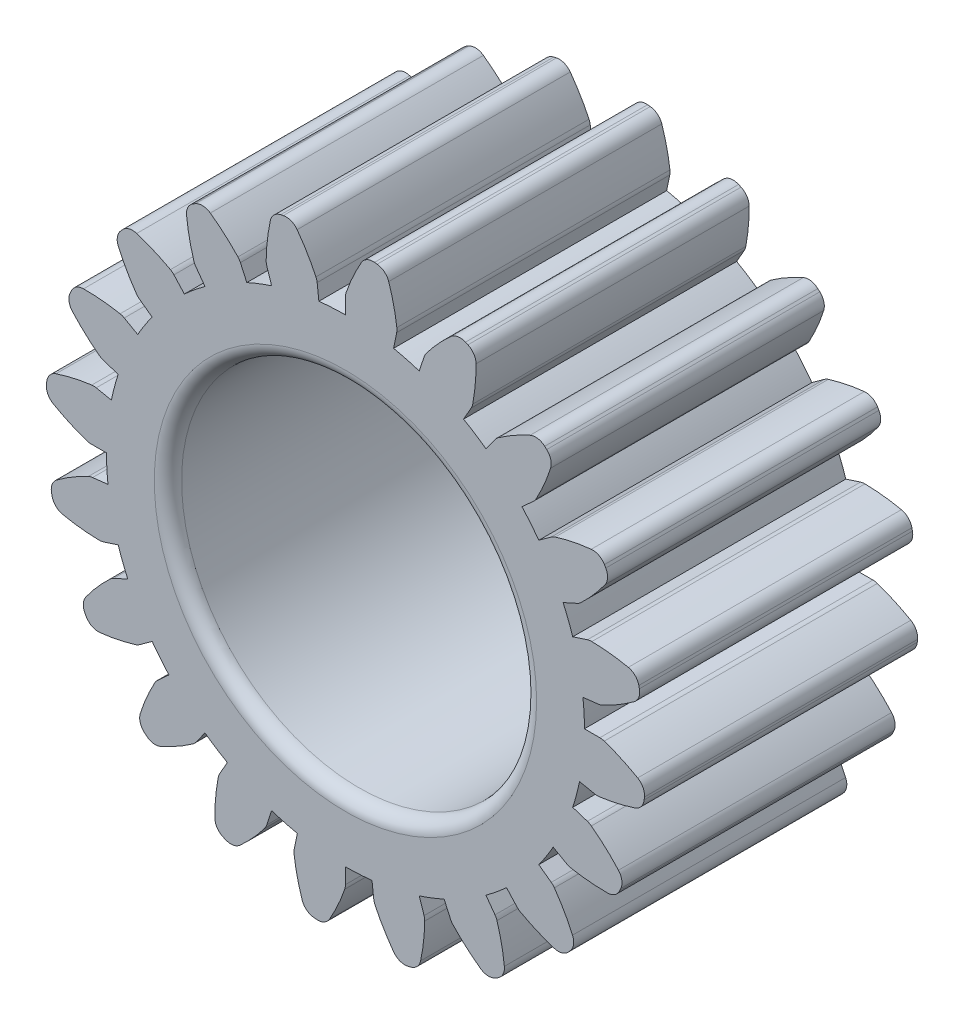
from build123d import *

# Parameters (mm, degrees)
SKETCH1_R                = 6.5
BOSS_EXTRUDE5_DEPTH      = 10
BOSS_EXTRUDE6_DEPTH      = 10
FILLET3_R                = 0.5
CIRPATTERN5_COUNT        = 20
FILLET3_OF_CIRPATTERN5_R = 0.5
FILLET2_R                = 0.5


with BuildPart() as part:
    # Sketch1 → Boss-Extrude5 (new body)
    with BuildSketch(Plane(origin=(0, 0, 0), x_dir=(0, 1, 0), z_dir=(0, 0, 1))):
        with BuildLine():
            ThreePointArc((1.761770315, 8.570803075), (0.885430147, 8.705085494), (0, 8.75))
            ThreePointArc((0, 8.75), (-6.187184335, -6.187184335), (8.75, 0))
            ThreePointArc((8.75, 0), (6.781518645, 5.529331322), (1.761770315, 8.570803075))
        make_face()
        Circle(SKETCH1_R, mode=Mode.SUBTRACT)
    extrude(amount=BOSS_EXTRUDE5_DEPTH)

    # Sketch2 → Boss-Extrude6 (add)
    with BuildSketch(Plane(origin=(0, 0, 0), x_dir=(0, 1, 0), z_dir=(0, 0, 1))):
        with BuildLine():
            Line((1.892025788, 9.204480462), (1.761770315, 8.570803075))
            ThreePointArc((1.761770315, 8.570803075), (0.885430147, 8.705085494), (0, 8.75))
            Line((0, 8.75), (0, 9.396926208))
            ThreePointArc((0, 9.396926208), (0.324589742, 10.209430853), (0.749151549, 10.974459985))
            ThreePointArc((0.749151549, 10.974459985), (1.113112185, 10.943536049), (1.475845419, 10.900544954))
            ThreePointArc((1.475845419, 10.900544954), (1.737677423, 10.065699878), (1.892025788, 9.204480462))
        make_face()
    boss_extrude6 = extrude(amount=BOSS_EXTRUDE6_DEPTH)

    # Fillet3
    fillet3_edges = [part.edges().sort_by_distance(p)[0] for p in [
        (-10.900544954, 1.475845419, 5),
        (-10.974459985, 0.749151549, 5),
        (-9.396926208, 0, 5),
        (-9.204480462, 1.892025788, 5),
    ]]
    fillet(fillet3_edges, radius=FILLET3_R)

    # CirPattern5: Boss-Extrude6 ×20 about axis
    cirpattern5_axis = Axis((0, 0, 10), (0, 0, -1))
    for i in range(1, CIRPATTERN5_COUNT):
        add(boss_extrude6.rotate(cirpattern5_axis, i * 360 / CIRPATTERN5_COUNT))

    # Fillet3 of CirPattern5
    fillet3_of_cirpattern5_edges = [part.edges().sort_by_distance(p)[0] for p in [
        (-9.910972994, 4.772066042, 5),
        (-10.205831121, 4.103780102, 5),
        (-8.937007903, 2.903809893, 5),
        (-8.169313, 4.643764342, 5),
        (-7.951245944, 7.601163591, 5),
        (-8.438184399, 7.056702066, 5),
        (-7.602272997, 5.523374642, 5),
        (-6.334476263, 6.940938887, 5),
        (-5.213195541, 9.686206288, 5),
        (-5.844549396, 9.318864864, 5),
        (-5.523374642, 7.602272997, 5),
        (-3.879576854, 8.558685973, 5),
        (-1.964841236, 10.823095625, 5),
        (-2.678809177, 10.668832241, 5),
        (-2.903809893, 8.937007903, 5),
        (-1.044917433, 9.338649245, 5),
        (1.475845419, 10.900544954, 5),
        (0.749151549, 10.974459985, 5),
        (0, 9.396926208, 5),
        (1.892025788, 9.204480462, 5),
        (4.772066042, 9.910972994, 5),
        (4.103780102, 10.205831121, 5),
        (2.903809893, 8.937007903, 5),
        (4.643764342, 8.169313, 5),
        (7.601163591, 7.951245944, 5),
        (7.056702066, 8.438184399, 5),
        (5.523374642, 7.602272997, 5),
        (6.940938887, 6.334476263, 5),
        (9.686206288, 5.213195541, 5),
        (9.318864864, 5.844549396, 5),
        (7.602272997, 5.523374642, 5),
        (8.558685973, 3.879576854, 5),
        (10.823095625, 1.964841236, 5),
        (10.668832241, 2.678809177, 5),
        (8.937007903, 2.903809893, 5),
        (9.338649245, 1.044917433, 5),
        (10.900544954, -1.475845419, 5),
        (10.974459985, -0.749151549, 5),
        (9.396926208, 0, 5),
        (9.204480462, -1.892025788, 5),
        (9.910972994, -4.772066042, 5),
        (10.205831121, -4.103780102, 5),
        (8.937007903, -2.903809893, 5),
        (8.169313, -4.643764342, 5),
        (7.951245944, -7.601163591, 5),
        (8.438184399, -7.056702066, 5),
        (7.602272997, -5.523374642, 5),
        (6.334476263, -6.940938887, 5),
        (5.213195541, -9.686206288, 5),
        (5.844549396, -9.318864864, 5),
        (5.523374642, -7.602272997, 5),
        (3.879576854, -8.558685973, 5),
        (1.964841236, -10.823095625, 5),
        (2.678809177, -10.668832241, 5),
        (2.903809893, -8.937007903, 5),
        (1.044917433, -9.338649245, 5),
        (-1.475845419, -10.900544954, 5),
        (-0.749151549, -10.974459985, 5),
        (0, -9.396926208, 5),
        (-1.892025788, -9.204480462, 5),
        (-4.772066042, -9.910972994, 5),
        (-4.103780102, -10.205831121, 5),
        (-2.903809893, -8.937007903, 5),
        (-4.643764342, -8.169313, 5),
        (-7.601163591, -7.951245944, 5),
        (-7.056702066, -8.438184399, 5),
        (-5.523374642, -7.602272997, 5),
        (-6.940938887, -6.334476263, 5),
        (-9.686206288, -5.213195541, 5),
        (-9.318864864, -5.844549396, 5),
        (-7.602272997, -5.523374642, 5),
        (-8.558685973, -3.879576854, 5),
        (-10.823095625, -1.964841236, 5),
        (-10.668832241, -2.678809177, 5),
        (-8.937007903, -2.903809893, 5),
        (-9.338649245, -1.044917433, 5),
    ]]
    fillet(fillet3_of_cirpattern5_edges, radius=FILLET3_OF_CIRPATTERN5_R)

    # Fillet2
    fillet2_edges = [part.edges().sort_by_distance(p)[0] for p in [
        (0, -6.5, 10),
    ]]
    fillet(fillet2_edges, radius=FILLET2_R)


solid = part.part
